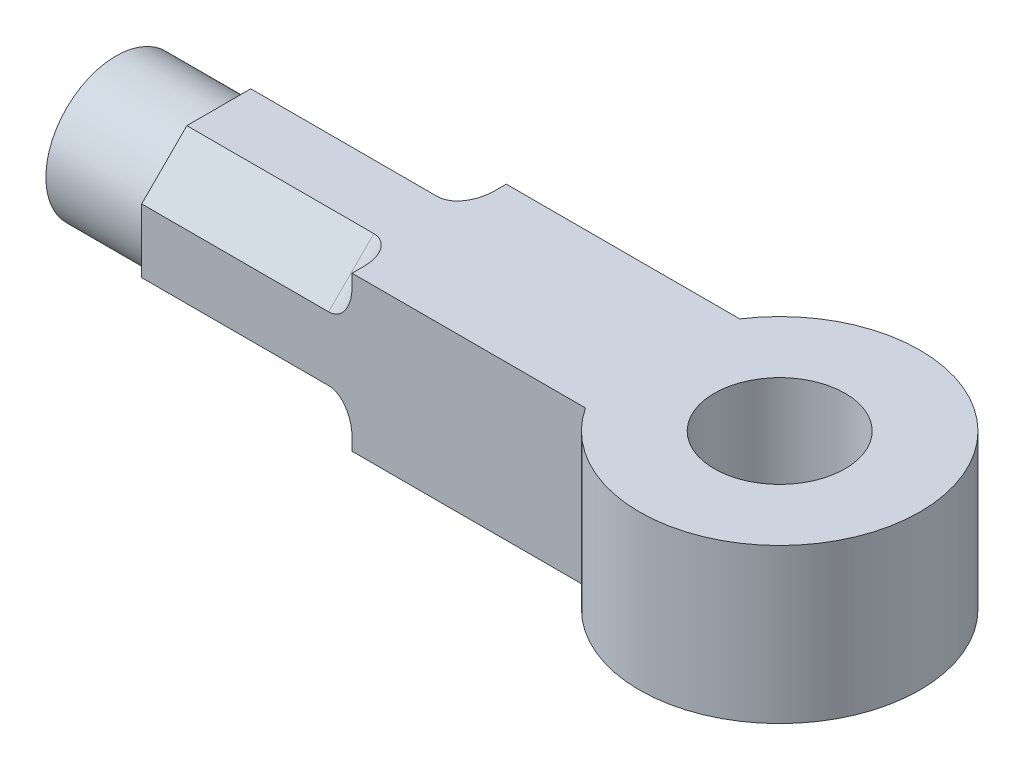
from build123d import *

# Parameters (mm, degrees)
SKETCH1_R                = 30
SKETCH1_R_2              = 14
BOSS_EXTRUDE1_DEPTH      = 18
BOSS_EXTRUDE2_DEPTH      = 45
SKETCH3_R                = 15
BOSS_EXTRUDE3_DEPTH      = 22
BOSS_EXTRUDE4_REACH      = 112.675
SKETCH4_W                = 33
SKETCH4_H                = 33
FILLET1_R                = 5
FILLET7_R                = 1.5
SCALA2_SCALE             = 0.1
SCHIZZO1_W               = 13.938376935
SCHIZZO1_H               = 12.715061938
TAGLIO_ESTRUSIONE1_DEPTH = 0.15
SCHIZZO2_W               = 8.711485585
SCHIZZO2_H               = 10.583528232
TAGLIO_ESTRUSIONE2_DEPTH = 0.15


with BuildPart() as part:
    # Sketch1 → Boss-Extrude1 (new, symmetric)
    with BuildSketch(Plane(origin=(0, 0, 0), x_dir=(1, 0, 0), z_dir=(0, 1, 0))):
        with Locations(Location((0, 0, 0), (0, 0, 270))):
            Circle(SKETCH1_R)
        with Locations(Location((0, 0, 0), (0, 0, 270))):
            Circle(SKETCH1_R_2, mode=Mode.SUBTRACT)
    extrude(amount=BOSS_EXTRUDE1_DEPTH, both=True)

    # Sketch4 → Boss-Extrude4 (add, up to next)
    with BuildSketch(Plane(origin=(-75, 0, 0), x_dir=(0, 0, -1), z_dir=(1, 0, 0)), mode=Mode.PRIVATE) as boss_extrude4_sk1:
        Rectangle(SKETCH4_W, SKETCH4_H)
    boss_extrude4_tool1 = extrude(boss_extrude4_sk1.sketch, amount=BOSS_EXTRUDE4_REACH, mode=Mode.PRIVATE) - part.part


with BuildPart() as body_2:
    # Sketch2 → Boss-Extrude2 (new body)
    with BuildSketch(Plane(origin=(-120, 0, 0), x_dir=(0, 0, -1), z_dir=(1, 0, 0))):
        Polygon((-16.5, 6.834523779), (-16.5, -6.834523779), (-6.834523779, -16.5), (6.834523779, -16.5), (16.5, -6.834523779), (16.5, 6.834523779), (6.834523779, 16.5), (-6.834523779, 16.5), align=None)
    extrude(amount=BOSS_EXTRUDE2_DEPTH)

    # Sketch3 → Boss-Extrude3 (add)
    with BuildSketch(Plane(origin=(-120, 0, 0), x_dir=(0, 0, -1), z_dir=(1, 0, 0))):
        Circle(SKETCH3_R)
    extrude(amount=-BOSS_EXTRUDE3_DEPTH)


with BuildPart() as part_1:
    add(part.part)

    add(body_2.part)  # Boss-Extrude4 merges body 2
    add(boss_extrude4_tool1.solids().sort_by_distance((-75, 0, 0))[0])

    # Fillet1
    fillet1_edges = [part_1.edges().sort_by_distance(p)[0] for p in [
        (-75, 11.66726189, 11.66726189),
        (-75, -11.66726189, 11.66726189),
        (-75, -11.66726189, -11.66726189),
        (-75, 11.66726189, -11.66726189),
    ]]
    fillet(fillet1_edges, radius=FILLET1_R)

    # Fillet7
    fillet7_edges = [part_1.edges().sort_by_distance(p)[0] for p in [
        (-30, -16.5, 0),
        (-30, 16.5, 0),
    ]]
    fillet(fillet7_edges, radius=FILLET7_R - 0.0001)  # a hair under: the kernel refuses the full size


with BuildPart() as part_2:
    # Scala2: scaled about (-46.241792436, -2e-09, 0)
    add(part_1.part.scale(SCALA2_SCALE).moved(Location((-41.617613192, -2e-09, 0))))

    # Schizzo1 → Taglio-Estrusione1 (cut)
    with BuildSketch(Plane(origin=(0, 1.8, 0), x_dir=(1, 0, 0), z_dir=(0, 1, 0))):
        with Locations((-40.78597266, -0.750670566)):
            Rectangle(SCHIZZO1_W, SCHIZZO1_H)
    extrude(amount=-TAGLIO_ESTRUSIONE1_DEPTH, mode=Mode.SUBTRACT)

    # Schizzo2 → Taglio-Estrusione2 (cut)
    with BuildSketch(Plane.XZ.offset(1.8)):
        with Locations((-41.379095083, -0.12974553)):
            Rectangle(SCHIZZO2_W, SCHIZZO2_H)
    extrude(amount=-TAGLIO_ESTRUSIONE2_DEPTH, mode=Mode.SUBTRACT)


solid = part_2.part
